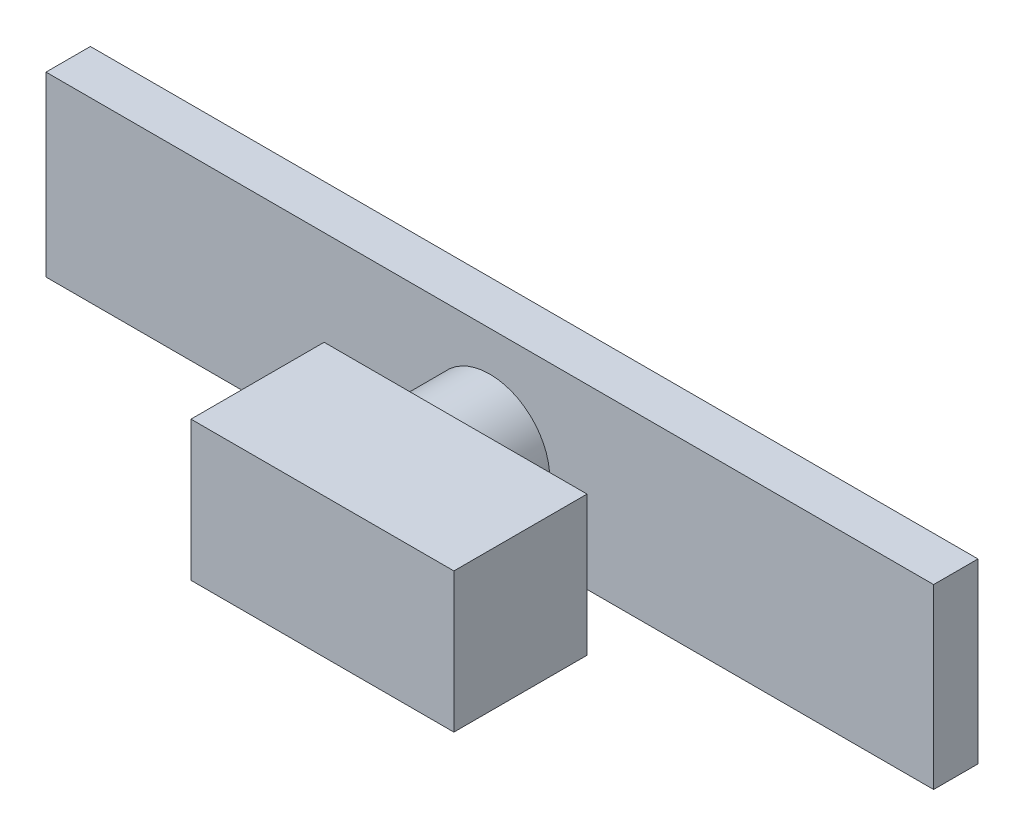
from build123d import *

# Parameters (mm, degrees)
SKETCH2_W             = 254
SKETCH2_H             = 12.7
BOSS_EXTRUDE1_DEPTH   = 50.8
SKETCH3_R             = 17.140791438
BOSS_EXTRUDE2_DEPTH   = 19.05
SKETCH4_W             = 75.235944222
SKETCH4_H             = 39.955088207
BOSS_EXTRUDE3_DEPTH   = 38.1
SCALE2_SCALE          = 0.06
BODY_MOVE_COPY1_ANGLE = 90
SCALE5_SCALE          = 0.25
SCALE6_SCALE          = 0.25


with BuildPart() as part:
    # Sketch2 → Boss-Extrude1 (new body)
    with BuildSketch(Plane.XY):
        with Locations((79.130769231, 14.898076923)):
            Rectangle(SKETCH2_W, SKETCH2_H)
    extrude(amount=BOSS_EXTRUDE1_DEPTH)

    # Sketch3 → Boss-Extrude2 (add)
    with BuildSketch(Plane(origin=(0, 21.248076923, 0), x_dir=(1, 0, 0), z_dir=(0, 1, 0))):
        with Locations((79.130769231, -28.483063876)):
            Circle(SKETCH3_R)
    extrude(amount=BOSS_EXTRUDE2_DEPTH)

    # Sketch4 → Boss-Extrude3 (add)
    with BuildSketch(Plane(origin=(0, 40.298076923, 0), x_dir=(1, 0, 0), z_dir=(0, 1, 0))):
        with Locations((88.38546847, -28.088530296)):
            Rectangle(SKETCH4_W, SKETCH4_H)
    extrude(amount=BOSS_EXTRUDE3_DEPTH)


with BuildPart() as part_1:
    # Scale2: scaled about (82.711857342, 33.041003565, 26.623476887)
    add(part.part.scale(SCALE2_SCALE).moved(Location((77.749145901, 31.058543351, 25.026068274))))


with BuildPart() as part_2:
    # Body-Move/Copy1: moved
    add(part_1.part.rotate(Axis((0, 33.666927966, 26.550068274), (1, 0, 0)), BODY_MOVE_COPY1_ANGLE))


with BuildPart() as part_3:
    # Body-Move/Copy3: moved
    add(part_2.part.moved(Location((-50.8, 0, -50.8))))


with BuildPart() as part_4:
    # Scale5: scaled about (31.911857342, 33.593519353, -24.875856127)
    add(part_3.part.scale(SCALE5_SCALE).moved(Location((23.933893006, 25.195139515, -18.656892095))))


with BuildPart() as part_5:
    # Body-Move/Copy9: moved
    add(part_4.part.moved(Location((-50.8, 0, 0))))


with BuildPart() as part_6:
    # Body-Move/Copy13: moved
    add(part_5.part.moved(Location((0, -50.8, 0))))


with BuildPart() as part_7:
    # Scale6: scaled about (-18.888142658, -17.206480647, -24.875856127)
    add(part_6.part.scale(SCALE6_SCALE).moved(Location((-14.166106993, -12.904860485, -18.656892095))))


with BuildPart() as part_8:
    # Body-Move/Copy16: moved
    add(part_7.part.moved(Location((0, 0, -12.7))))


with BuildPart() as part_9:
    # Body-Move/Copy17: moved
    add(part_8.part.moved(Location((0, 0, -76.2))))


solid = part_9.part
